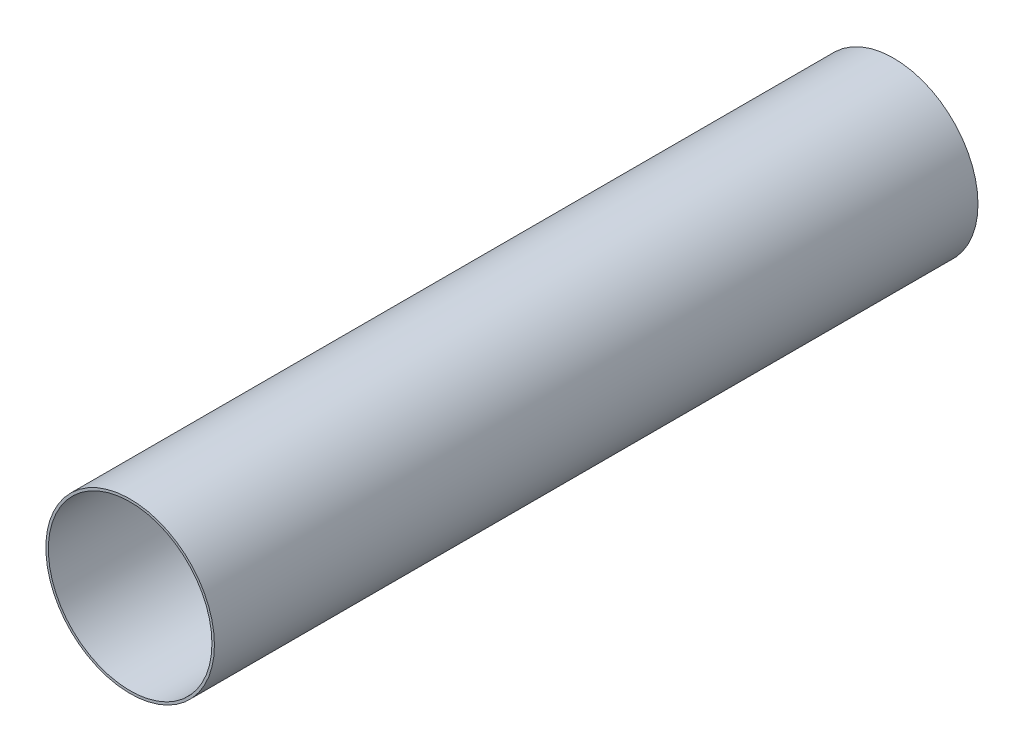
from build123d import *

# Parameters (mm, degrees)
SKETCH1_R           = 39.2557
SKETCH1_R_2         = 38.1
BOSS_EXTRUDE1_DEPTH = 177.8


with BuildPart() as part:
    # Sketch1 → Boss-Extrude1 (new, symmetric)
    with BuildSketch(Plane.XY):
        Circle(SKETCH1_R)
        Circle(SKETCH1_R_2, mode=Mode.SUBTRACT)
    extrude(amount=BOSS_EXTRUDE1_DEPTH, both=True)


solid = part.part
